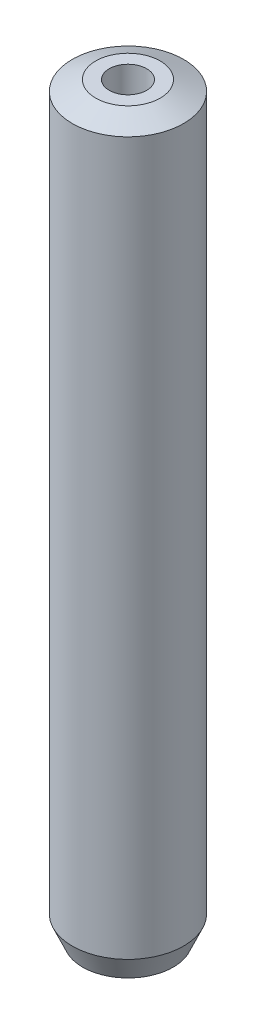
from build123d import *
from OCP.BRepFilletAPI import BRepFilletAPI_MakeChamfer

# Parameters (mm, degrees)
SKETCH1_R           = 15
BOSS_EXTRUDE1_DEPTH = 201.104191988
SKETCH2_R           = 5.055957982
CUT_EXTRUDE1_DEPTH  = 203.219919976
CHAMFER1_SIZE       = 2.778483119
CHAMFER1_SIZE2      = 6.313509598


with BuildPart() as part:
    # Sketch1 → Boss-Extrude1 (new body)
    with BuildSketch(Plane(origin=(0, 0, 0), x_dir=(1, 0, 0), z_dir=(0, 1, 0))):
        Circle(SKETCH1_R)
    extrude(amount=BOSS_EXTRUDE1_DEPTH)

    # Sketch2 → Cut-Extrude1 (cut, through all)
    with BuildSketch(Plane(origin=(0, 0, 0), x_dir=(1, 0, 0), z_dir=(0, 1, 0))):
        Circle(SKETCH2_R)
    extrude(amount=CUT_EXTRUDE1_DEPTH, mode=Mode.SUBTRACT)

    # Chamfer1: one chamfer whose edges measure the first distance from different faces: ONE call of the kernel's chamfer builder (chamfer() names one face for all edges)
    chamfer1_edges_1 = [part.edges().sort_by_distance(p)[0] for p in [
        (-15, 201.104191988, 0),
    ]]
    chamfer1_side_1 = [part.faces().sort_by_distance(p)[0] for p in [
        (-15, 100.552095994, 0),
    ]]
    chamfer1_edges_2 = [part.edges().sort_by_distance(p)[0] for p in [
        (-15, 0, 0),
    ]]
    chamfer1_side_2 = [part.faces().sort_by_distance(p)[0] for p in [
        (-14.575735931, 0, 0),
    ]]
    chamfer1 = BRepFilletAPI_MakeChamfer(part.part.solid().wrapped)
    for e in chamfer1_edges_1:
        chamfer1.Add(CHAMFER1_SIZE, CHAMFER1_SIZE2, e.wrapped, chamfer1_side_1[0].wrapped)  # the first distance lies on this face
    for e in chamfer1_edges_2:
        chamfer1.Add(CHAMFER1_SIZE, CHAMFER1_SIZE2, e.wrapped, chamfer1_side_2[0].wrapped)  # the first distance lies on this face
    add(Compound.cast(chamfer1.Shape()), mode=Mode.REPLACE)


solid = part.part
